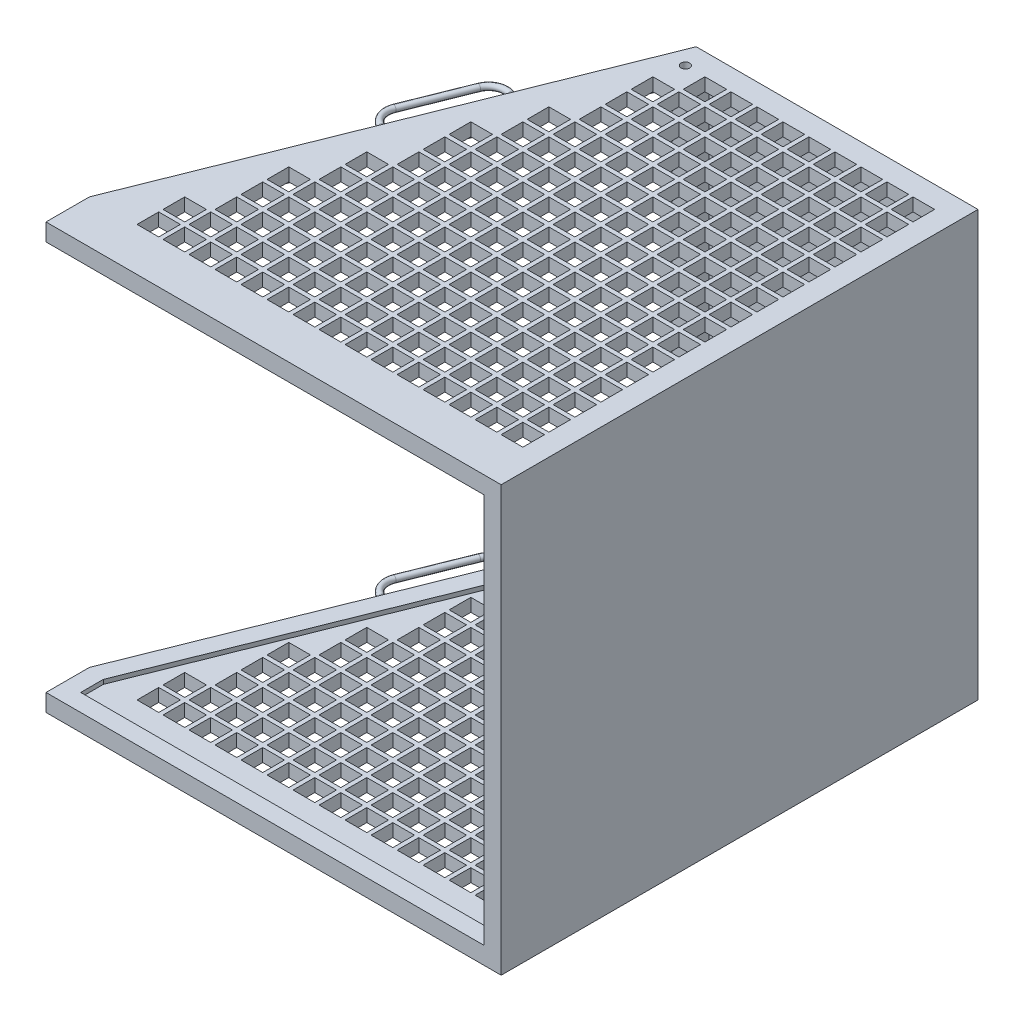
from build123d import *

# Parameters (mm, degrees)
BOSS_EXTRUDE1_DEPTH  = 490
CUT_EXTRUDE1_DEPTH   = 980
SKETCH3_W            = 1010
SKETCH3_H            = 1060
CUT_EXTRUDE2_DEPTH   = 450
BOSS_EXTRUDE2_DEPTH  = 30
SKETCH6_W            = 570
SKETCH6_H            = 900
CUT_EXTRUDE3_DEPTH   = 50
SKETCH7_W            = 1020
SKETCH7_H            = 900
CUT_EXTRUDE5_DEPTH   = 30
SKETCH9_W            = 590
SKETCH9_H            = 920
CUT_EXTRUDE6_DEPTH   = 10
SKETCH10_W           = 50
SKETCH10_H           = 50
CUT_EXTRUDE8_DEPTH   = 1244.843728829
LPATTERN1_COUNT      = 15
LPATTERN1_PITCH      = 60
LPATTERN1_COUNT_DIR2 = 16
LPATTERN1_PITCH_DIR2 = 60
SKETCH11_R           = 10
CUT_EXTRUDE9_DEPTH   = 1244.843728829
SKETCH12_W           = 590
SKETCH12_H           = 920
BOSS_EXTRUDE3_DEPTH  = 5
SKETCH14_R           = 7


with BuildPart() as part:
    # Sketch1 → Boss-Extrude1 (new, symmetric)
    with BuildSketch(Plane(origin=(0, 0, 0), x_dir=(1, 0, 0), z_dir=(0, 1, 0))):
        Polygon((-533.148404993, -550), (-533.148404993, -450), (-133.148404993, 550), (516.851595007, 550), (516.851595007, -550), align=None)
    extrude(amount=BOSS_EXTRUDE1_DEPTH, both=True)

    # Sketch2 → Cut-Extrude1 (cut)
    with BuildSketch(Plane(origin=(0, 490, 0), x_dir=(1, 0, 0), z_dir=(0, 1, 0))):
        Polygon((476.851595007, -510), (476.851595007, 510), (-106.067086536, 510), (-493.148404993, -457.703296143), (-493.148404993, -510), align=None)
    extrude(amount=-CUT_EXTRUDE1_DEPTH, mode=Mode.SUBTRACT)

    # Sketch3 → Cut-Extrude2 (cut, symmetric)
    with BuildSketch(Plane(origin=(0, 0, 0), x_dir=(1, 0, 0), z_dir=(0, 1, 0))):
        with Locations((-28.148404993, -20)):
            Rectangle(SKETCH3_W, SKETCH3_H)
    extrude(amount=CUT_EXTRUDE2_DEPTH, both=True, mode=Mode.SUBTRACT)

    # Sketch5 → Boss-Extrude2 (add)
    with BuildSketch(Plane(origin=(0, 490, 0), x_dir=(1, 0, 0), z_dir=(0, 1, 0))):
        Polygon((-493.148404993, -510), (-493.148404993, -457.703296143), (-106.067086536, 510), (476.851595007, 510), (476.851595007, -510), align=None)
    boss_extrude2 = extrude(amount=-BOSS_EXTRUDE2_DEPTH)

    # Mirror2: Boss-Extrude2 across plane
    add(boss_extrude2.mirror(Plane.ZX))

    # Sketch6 → Cut-Extrude3 (cut)
    with BuildSketch(Plane.XY.offset(-510)):
        with Locations((191.851595007, 0)):
            Rectangle(SKETCH6_W, SKETCH6_H)
    extrude(amount=-CUT_EXTRUDE3_DEPTH, mode=Mode.SUBTRACT)

    # Sketch7 → Cut-Extrude5 (cut)
    with BuildSketch(Plane.ZY.offset(-476.851595007)):
        Rectangle(SKETCH7_W, SKETCH7_H)
    extrude(amount=-CUT_EXTRUDE5_DEPTH, mode=Mode.SUBTRACT)

    # Sketch9 → Cut-Extrude6 (cut)
    with BuildSketch(Plane(origin=(0, 0, -550), x_dir=(-1, 0, 0), z_dir=(0, 0, -1))):
        with Locations((-191.851595007, 0)):
            Rectangle(SKETCH9_W, SKETCH9_H)
    extrude(amount=-CUT_EXTRUDE6_DEPTH, mode=Mode.SUBTRACT)

    # Sketch10 → Cut-Extrude8 (cut, through all)
    with BuildSketch(Plane(origin=(0, 490, 0), x_dir=(1, 0, 0), z_dir=(0, 1, 0))):
        with Locations((441.851595007, 475)):
            Rectangle(SKETCH10_W, SKETCH10_H)
    cut_extrude8 = extrude(amount=-CUT_EXTRUDE8_DEPTH, mode=Mode.SUBTRACT)

    # LPattern1: Cut-Extrude8 15 × 16, 45 skipped
    with Locations(*[(-i * LPATTERN1_PITCH, 0, j * LPATTERN1_PITCH_DIR2) for i in range(LPATTERN1_COUNT) for j in range(LPATTERN1_COUNT_DIR2) if (i, j) not in ((0, 0), (9, 0), (10, 0), (10, 1), (10, 2), (10, 3), (11, 0), (11, 1), (11, 2), (11, 3), (11, 4), (11, 5), (12, 0), (12, 1), (12, 2), (12, 3), (12, 4), (12, 5), (12, 6), (12, 7), (12, 8), (13, 0), (13, 1), (13, 2), (13, 3), (13, 4), (13, 5), (13, 6), (13, 7), (13, 8), (13, 9), (13, 10), (14, 0), (14, 1), (14, 2), (14, 3), (14, 4), (14, 5), (14, 6), (14, 7), (14, 8), (14, 9), (14, 10), (14, 11), (14, 12), (14, 13))]):
        add(cut_extrude8, mode=Mode.SUBTRACT)

    # Sketch11 → Cut-Extrude9 (cut, through all)
    with BuildSketch(Plane(origin=(0, 490, 0), x_dir=(1, 0, 0), z_dir=(0, 1, 0))):
        with Locations((-108.148404993, 500)):
            Circle(SKETCH11_R)
    extrude(amount=-CUT_EXTRUDE9_DEPTH, mode=Mode.SUBTRACT)

    # Sweep1: sweep along a path in Sketch13
    with BuildLine(Plane(origin=(0, 470, 0), x_dir=(1, 0, 0), z_dir=(0, 1, 0))) as sweep1_path:
        Line((-251.993421426, 252.887458917), (-270.562955244, 260.315272444))
        ThreePointArc((-270.562955244, 260.315272444), (-301.175354241, 259.942006009), (-322.557649934, 238.031831863))
        Line((-322.557649934, 238.031831863), (-378.266251387, 98.76032823))
        ThreePointArc((-378.266251387, 98.76032823), (-377.892984952, 68.147929232), (-355.982810806, 46.76563354))
        Line((-355.982810806, 46.76563354), (-337.413276988, 39.337820013))
    # Sketch14 → Sweep1 (sweep)
    with BuildSketch(Plane(origin=(-304.438280166, 0, -121.775312067), x_dir=(-0.3713906763541037, 0, 0.9284766908852594), z_dir=(-0.9284766908852593, 0, -0.37139067635410367))):
        with Locations((-141.212103801, 470)):
            Circle(SKETCH14_R)
    sweep1 = sweep(path=sweep1_path.line)

    # Mirror3: Sweep1 across plane
    add(sweep1.mirror(Plane.ZX))


with BuildPart() as body_2:
    # Sketch12 → Boss-Extrude3 (new body)
    with BuildSketch(Plane(origin=(0, 0, -540), x_dir=(-1, 0, 0), z_dir=(0, 0, -1))):
        with Locations((-191.851595007, 0)):
            Rectangle(SKETCH12_W, SKETCH12_H)
    extrude(amount=BOSS_EXTRUDE3_DEPTH)


solid = Compound([part.part, body_2.part])
